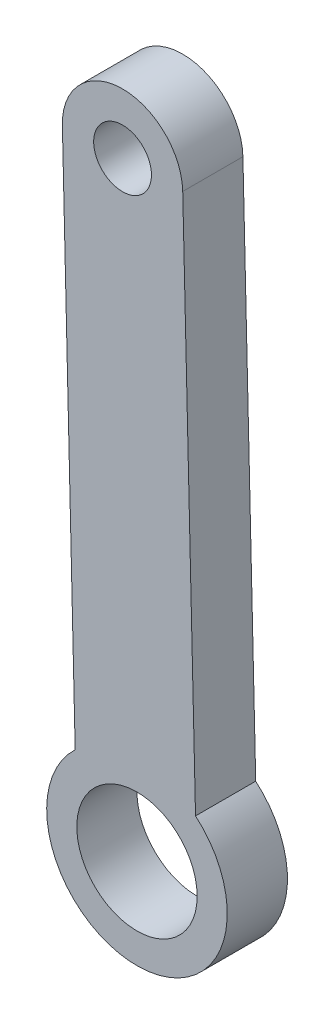
from build123d import *

# Parameters (mm, degrees)
SKETCH1_R           = 2.4
SKETCH1_R_2         = 5
BOSS_EXTRUDE1_DEPTH = 5


with BuildPart() as part:
    # Sketch1 → Boss-Extrude1 (new body)
    with BuildSketch(Plane(origin=(0, 0, 0), x_dir=(0.9997134963974095, 0.023935854295735675, 0), z_dir=(0, 0, 1))):
        with BuildLine():
            Line((10.010039278, 5.570210903), (10.010039278, 49.980040959))
            ThreePointArc((10.010039278, 49.980040959), (5.010039278, 54.980040959), (0.010039278, 49.980040959))
            Line((0.010039278, 49.980040959), (0.010039278, 5.570210903))
            ThreePointArc((0.010039278, 5.570210903), (5.010039278, -7.519959041), (10.010039278, 5.570210903))
        make_face()
        with Locations((5.010039278, 49.980040959)):
            Circle(SKETCH1_R, mode=Mode.SUBTRACT)
        with Locations((5.010039278, -0.019959041)):
            Circle(SKETCH1_R_2, mode=Mode.SUBTRACT)
    extrude(amount=BOSS_EXTRUDE1_DEPTH)


solid = part.part
